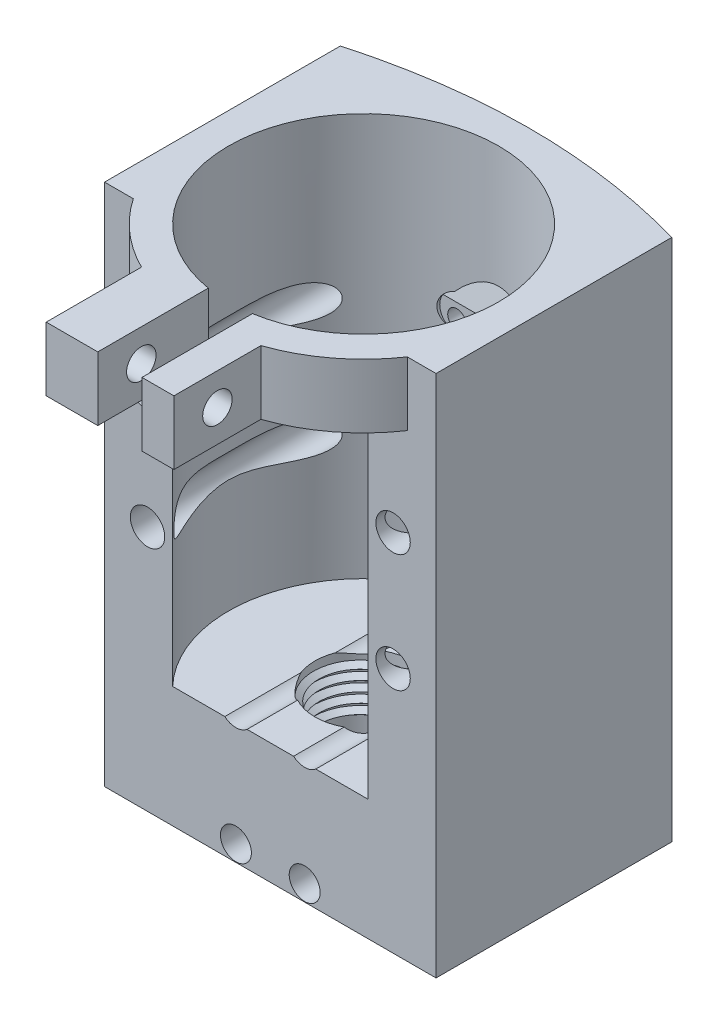
from build123d import *

# Parameters (mm, degrees)
PLAQUE_VISS_R           = 1.875
PLAQUE_VISS_R_2         = 3.5
BOSS_EXTRU_1_DEPTH      = 3
ESQUISSE_FILETAGE_W     = 67.5
ESQUISSE_FILETAGE_H     = 45
ESQUISSE_FILETAGE_R     = 9.9
BOSS_EXTRU_4_DEPTH      = 24.6
PLAQUE_VISS_6_R         = 1.875
ENL_V_MAT_EXTRU_6_DEPTH = 48
BOSS_EXTRU_8_DEPTH      = 13
ENL_V_MAT_EXTRU_1_REACH = 111.491
ESQUISSE15_R            = 3
ESQUISSE15_4_W          = 24.476392912
ESQUISSE15_4_H          = 13
BOSS_EXTRU_9_DEPTH      = 4
BALAYAGE1_PITCH         = 2
BALAYAGE1_HEIGHT        = 10.6
BALAYAGE1_RADIUS        = 9.9
BOSS_EXTRU_22_DEPTH     = 26.4
ESQUISSE28_R            = 27.5
ENL_V_MAT_EXTRU_8_DEPTH = 24
BOSS_EXTRU_28_START     = 82
BOSS_EXTRU_28_DEPTH     = 82
ESQUISSE23_R            = 3.5
ESQUISSE23_R_2          = 3.15
ENL_V_MAT_EXTRU_7_DEPTH = 104.256472222
CHANFREIN4_SIZE         = 6.344486373
CHANFREIN4_SIZE_2       = 1.7


with BuildPart() as part:
    # Plaque vissé → Boss.-Extru.1 (new body)
    # profile 1 of 2: a face of its own
    with BuildSketch(Plane.XY):
        Polygon((0, -61.668812928), (0, 18.531187072), (-31, 18.531187072), (-33.75, 18.531187072), (-33.75, -61.668812928), (-31, -61.668812928), align=None)
        with Locations((-7, -58.39890353)):
            Circle(PLAQUE_VISS_R, mode=Mode.SUBTRACT)
        with Locations((-17, -33.39890353)):
            Circle(PLAQUE_VISS_R_2, mode=Mode.SUBTRACT)
        with Locations((-7, -34.39890353)):
            Circle(PLAQUE_VISS_R, mode=Mode.SUBTRACT)
        with Locations((-25, -12.39890353)):
            Circle(PLAQUE_VISS_R, mode=Mode.SUBTRACT)
        with Locations((-7, -12.39890353)):
            Circle(PLAQUE_VISS_R, mode=Mode.SUBTRACT)
        with Locations((-25, 11.60109647)):
            Circle(PLAQUE_VISS_R, mode=Mode.SUBTRACT)
        with Locations((-7, 11.60109647)):
            Circle(PLAQUE_VISS_R, mode=Mode.SUBTRACT)
    # profile 2 of 2: a face of its own
    with BuildSketch(Plane.XY):
        Polygon((31, 18.531187072), (0, 18.531187072), (0, -61.668812928), (31, -61.668812928), (33.75, -61.668812928), (33.75, 18.531187072), align=None)
        with Locations((7, -58.39890353)):
            Circle(PLAQUE_VISS_R, mode=Mode.SUBTRACT)
        with Locations((7, -34.39890353)):
            Circle(PLAQUE_VISS_R, mode=Mode.SUBTRACT)
        with Locations((17, -33.39890353)):
            Circle(PLAQUE_VISS_R_2, mode=Mode.SUBTRACT)
        with Locations((7, -12.39890353)):
            Circle(PLAQUE_VISS_R, mode=Mode.SUBTRACT)
        with Locations((25, -12.39890353)):
            Circle(PLAQUE_VISS_R, mode=Mode.SUBTRACT)
        with Locations((7, 11.60109647)):
            Circle(PLAQUE_VISS_R, mode=Mode.SUBTRACT)
        with Locations((25, 11.60109647)):
            Circle(PLAQUE_VISS_R, mode=Mode.SUBTRACT)
    extrude(amount=BOSS_EXTRU_1_DEPTH)



with BuildPart() as body_2:
    # esquisse filetage → Boss.-Extru.4 (new body)
    with BuildSketch(Plane(origin=(0, -61.668812928, 0), x_dir=(-1, 0, 0), z_dir=(0, -1, 0))):
        with Locations((0, -25.5)):
            Rectangle(ESQUISSE_FILETAGE_W, ESQUISSE_FILETAGE_H)
        with Locations(Location((0, -29, 0), (0, 0, 90))):
            Circle(ESQUISSE_FILETAGE_R, mode=Mode.SUBTRACT)
    extrude(amount=-BOSS_EXTRU_4_DEPTH)

    # Plaque vissé<6> → Enlèv. mat.-Extru.6 (cut)
    with BuildSketch(Plane.XY):
        with Locations(Location((7, -58.39890353, 0), (0, 0, 180))):
            Circle(PLAQUE_VISS_6_R)
        with Locations(Location((-7, -58.39890353, 0), (0, 0, 180))):
            Circle(PLAQUE_VISS_6_R)
    extrude(amount=ENL_V_MAT_EXTRU_6_DEPTH, mode=Mode.SUBTRACT)


with BuildPart() as body_3:
    # Esquisse14 → Boss.-Extru.8 (new body)
    with BuildSketch(Plane(origin=(0, 44.931187072, 0), x_dir=(1, 0, 0), z_dir=(0, 1, 0))):
        with BuildLine():
            Line((-4.5, -56.129319933), (-4.5, -78.629319933))
            Line((-4.5, -78.629319933), (-11, -78.629319933))
            Line((-11, -78.629319933), (-11, -60.907091688))
            ThreePointArc((-11, -60.907091688), (0, 4.75), (11, -60.907091688))
            Line((11, -60.907091688), (11, -78.629319933))
            Line((11, -78.629319933), (4.5, -78.629319933))
            Line((4.5, -78.629319933), (4.5, -56.129319933))
            ThreePointArc((4.5, -56.129319933), (0, -1.5), (-4.5, -56.129319933))
        make_face()
    extrude(amount=-BOSS_EXTRU_8_DEPTH)

    # Enlèv. mat.-Extru.1: up to this face of the body (flat: up to its plane)
    enl_v_mat_extru_1_end = Plane(body_3.part.faces().sort_by_distance((11, 38.431187072, 69.76820581))[0])
    # Esquisse15 → Enlèv. mat.-Extru.1 (cut, up to the picked face)
    with BuildSketch(Plane.ZY.offset(11), mode=Mode.PRIVATE) as enl_v_mat_extru_1_sk1:
        with Locations((69.76820581, 38.431187072)):
            Circle(ESQUISSE15_R)
    enl_v_mat_extru_1_tool1 = split(extrude(enl_v_mat_extru_1_sk1.sketch, amount=-ENL_V_MAT_EXTRU_1_REACH, mode=Mode.PRIVATE), bisect_by=enl_v_mat_extru_1_end, keep=Keep.BOTH, mode=Mode.PRIVATE)
    add(enl_v_mat_extru_1_tool1.solids().sort_by(Axis((-11, 38.431187, 69.768206), (1, 0, 0)))[0], mode=Mode.SUBTRACT)

    # Esquisse15<4> → Boss.-Extru.9 (add)
    with BuildSketch(Plane.ZY.offset(11)):
        with Locations((66.391123477, 38.431187072)):
            Rectangle(ESQUISSE15_4_W, ESQUISSE15_4_H)
        Polygon((66.881454464, 43.431187072), (63.994703118, 38.431187072), (66.881454464, 33.431187072), (72.654957156, 33.431187072), (75.541708502, 38.431187072), (72.654957156, 43.431187072), align=None, mode=Mode.SUBTRACT)
    extrude(amount=BOSS_EXTRU_9_DEPTH)


with BuildPart() as body_4:
    # Balayage1: sweep along a helix
    with BuildLine() as balayage1_path:
        Helix(BALAYAGE1_PITCH, BALAYAGE1_HEIGHT, BALAYAGE1_RADIUS, center=(0, -38.858812928, 29), direction=(0, -1, 0))
    # Esquisse13 → Balayage1 (sweep)
    with BuildSketch(Plane(origin=(0, -55, 43.1), x_dir=(0, 0, -1), z_dir=(-1, 0, 0))):
        Polygon((24, -16.141187072), (22.88, -16.951187072), (24, -17.761187072), align=None)
    sweep(path=balayage1_path.line, is_frenet=True)


with BuildPart() as part_1:
    add(part.part)

    add(body_3.part)  # Boss.-Extru.22 merges body 3
    # Esquisse16 → Boss.-Extru.22 (add)
    with BuildSketch(Plane(origin=(0, 18.531187072, 0), x_dir=(1, 0, 0), z_dir=(0, 1, 0))):
        with BuildLine():
            Line((33.75, -3), (33.75, 0))
            add(Edge.make_bspline(
                [(33.75, 0), (0.086487745, 9.500021706), (-33.75, 0)],
                knots=[0, 0, 0, 1, 1, 1], degree=2))
            Line((-33.75, 0), (-33.75, -3))
            Line((-33.75, -3), (33.75, -3))
        make_face()
    extrude(amount=BOSS_EXTRU_22_DEPTH)

    # Esquisse28 → Enlèv. mat.-Extru.8 (cut)
    with BuildSketch(Plane(origin=(0, 44.931187072, 0), x_dir=(1, 0, 0), z_dir=(0, 1, 0))):
        with Locations((0, -29)):
            Circle(ESQUISSE28_R)
    extrude(amount=-ENL_V_MAT_EXTRU_8_DEPTH, mode=Mode.SUBTRACT)


    add(body_2.part)  # Boss.-Extru.28 merges body 2
    # Esquisse29 → Boss.-Extru.28 (add)
    with BuildSketch(Plane(origin=(0, -37.068812928, 0), x_dir=(1, 0, 0), z_dir=(0, 1, 0)).offset(BOSS_EXTRU_28_START)):
        with BuildLine():
            Line((33.75, -3), (33.75, -48))
            Line((33.75, -48), (19.880895352, -48))
            ThreePointArc((19.880895352, -48), (26.724031891, -22.513389216), (8.958236434, -3))
            Line((8.958236434, -3), (33.75, -3))
        make_face()
    boss_extru_28 = extrude(amount=-BOSS_EXTRU_28_DEPTH)

    # Symétrie1: Boss.-Extru.28 across plane
    add(boss_extru_28.mirror(Plane(origin=(0, 0, 0), x_dir=(0, 0, 1), z_dir=(1, 0, 0))))


with BuildPart() as enl_v_mat_extru_7_tool:
    # Esquisse23 → Enlèv. mat.-Extru.7 (new, through all)
    with BuildSketch(Plane.XY.offset(3)):
        with Locations((25, 12.5)):
            Circle(ESQUISSE23_R)
        with Locations((7, 12.5)):
            Circle(ESQUISSE23_R)
        with Locations((-7, 12.5)):
            Circle(ESQUISSE23_R)
        with Locations((-25, 12.5)):
            Circle(ESQUISSE23_R)
        with Locations((25, -11.5)):
            Circle(ESQUISSE23_R)
        with Locations((7, -11.5)):
            Circle(ESQUISSE23_R)
        with Locations((-7, -11.5)):
            Circle(ESQUISSE23_R)
        with Locations((-25, -11.5)):
            Circle(ESQUISSE23_R)
        with Locations((-7, -34.39890353)):
            Circle(ESQUISSE23_R)
        with Locations((7, -58.39890353)):
            Circle(ESQUISSE23_R_2)
        with Locations((-7, -58.39890353)):
            Circle(ESQUISSE23_R_2)
        with Locations((7, -34.39890353)):
            Circle(ESQUISSE23_R)
    extrude(amount=ENL_V_MAT_EXTRU_7_DEPTH)


with BuildPart() as part_2:
    add(part_1.part)

    # Enlèv. mat.-Extru.7: cut by enl_v_mat_extru_7_tool
    add(enl_v_mat_extru_7_tool.part, mode=Mode.SUBTRACT)

    # Chanfrein4
    # the kernel refuses this chamfer: 6.344486373, 1.7 mm, written as the material it takes off along each edge
    with BuildSketch(Plane(origin=(25.43310105, 20.931187072, 3), x_dir=(0, -0.9999503267608394, 0.009967146577156336), z_dir=(-1, 0, 0))) as chanfrein4_piece_1_section:
        Polygon((CHANFREIN4_SIZE * 0.99995032674, -CHANFREIN4_SIZE * 0.00996714657695), (-CHANFREIN4_SIZE_2 * 0.00996714657716, -CHANFREIN4_SIZE_2 * 0.999950326761), (0, 0), align=None)
    chanfrein4_piece_1 = extrude(amount=50.8662021, mode=Mode.PRIVATE)
    chanfrein4_piece_1 = chanfrein4_piece_1 & Plane(origin=(-7, 12.5, 2.892665546), x_dir=(1, 0, 0), z_dir=(0, 0, -1)) * Cylinder(3.5, 128, mode=Mode.PRIVATE)
    add(chanfrein4_piece_1, mode=Mode.SUBTRACT)
    with BuildSketch(Plane(origin=(25.43310105, 20.931187072, 3), x_dir=(0, -0.9999503267608394, 0.009967146577156336), z_dir=(-1, 0, 0))) as chanfrein4_piece_2_section:
        Polygon((CHANFREIN4_SIZE * 0.99995032674, -CHANFREIN4_SIZE * 0.00996714657695), (-CHANFREIN4_SIZE_2 * 0.00996714657716, -CHANFREIN4_SIZE_2 * 0.999950326761), (0, 0), align=None)
    chanfrein4_piece_2 = extrude(amount=50.8662021, mode=Mode.PRIVATE)
    chanfrein4_piece_2 = chanfrein4_piece_2 & Plane(origin=(0, 18.689054078, 29), x_dir=(0.16363636363636394, 0, 0.9865207248182208), z_dir=(0, 1, 0)) * Cylinder(27.5, 128, mode=Mode.PRIVATE)
    add(chanfrein4_piece_2, mode=Mode.SUBTRACT)
    with BuildSketch(Plane(origin=(25.43310105, 20.931187072, 3), x_dir=(0, -0.9999503267608394, 0.009967146577156336), z_dir=(-1, 0, 0))) as chanfrein4_piece_3_section:
        Polygon((CHANFREIN4_SIZE * 0.99995032674, -CHANFREIN4_SIZE * 0.00996714657695), (-CHANFREIN4_SIZE_2 * 0.00996714657716, -CHANFREIN4_SIZE_2 * 0.999950326761), (0, 0), align=None)
    chanfrein4_piece_3 = extrude(amount=50.8662021, mode=Mode.PRIVATE)
    chanfrein4_piece_3 = chanfrein4_piece_3 & Plane(origin=(7, 12.5, 2.892665534), x_dir=(1, 0, 0), z_dir=(0, 0, -1)) * Cylinder(3.5, 128, mode=Mode.PRIVATE)
    add(chanfrein4_piece_3, mode=Mode.SUBTRACT)


with BuildPart() as body_4_1:
    add(body_4.part)

    # Enlèv. mat.-Extru.7: cut by enl_v_mat_extru_7_tool
    add(enl_v_mat_extru_7_tool.part, mode=Mode.SUBTRACT)


solid = Compound([part_2.part, body_4_1.part])
